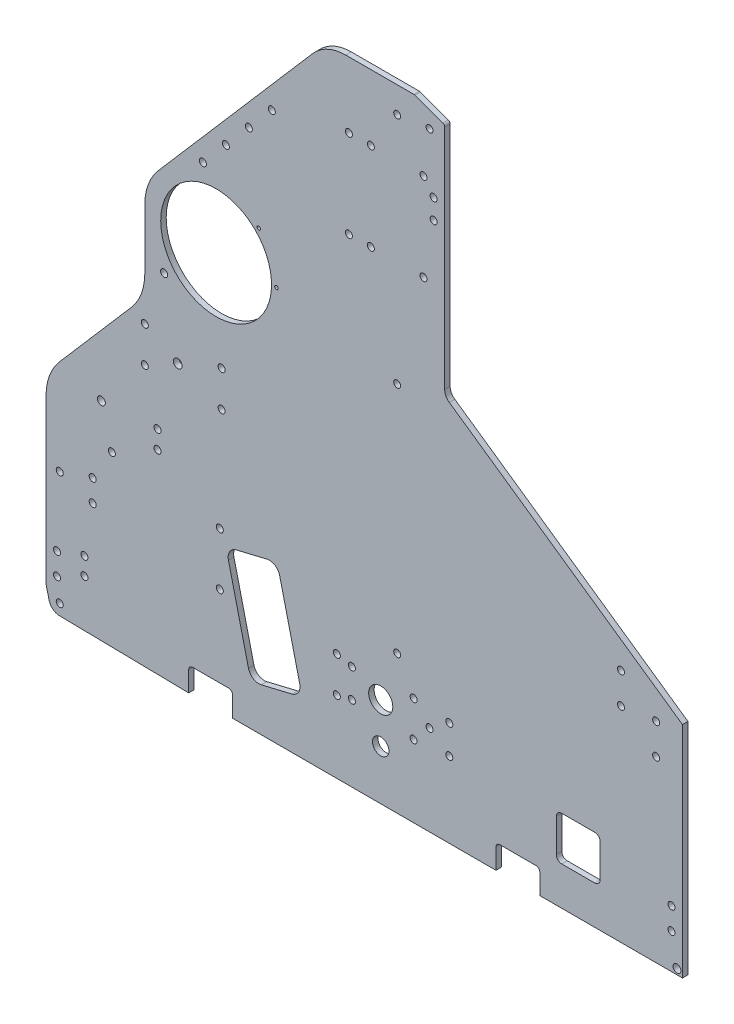
from build123d import *

# Parameters (mm, degrees)
SKETCH1_R           = 2.032
SKETCH1_R_2         = 2.54
SKETCH1_R_3         = 2
BOSS_EXTRUDE1_DEPTH = 3.175
FILLET1_R           = 2.286
FILLET2_R           = 6.35
SKETCH2_R           = 2.032
CUT_EXTRUDE1_DEPTH  = 505.524983177
FILLET3_R           = 1.5875
SKETCH3_R           = 2.032
SKETCH3_R_2         = 2.286
SKETCH3_R_3         = 1.016
CUT_EXTRUDE2_DEPTH  = 505.524983177
SKETCH4_R           = 2.032
SKETCH4_R_2         = 6.985
SKETCH4_R_3         = 4.7625
CUT_EXTRUDE3_DEPTH  = 505.524983177
SKETCH5_R           = 32.0675
SKETCH5_R_2         = 2.286
CUT_EXTRUDE5_DEPTH  = 540.282511836
FILLET4_R           = 31.75
CUT_EXTRUDE6_DEPTH  = 505.524983177
FILLET5_R           = 25.4
SKETCH8_R           = 2.032
CUT_EXTRUDE7_DEPTH  = 505.524983177


with BuildPart() as part:
    # Sketch1 → Boss-Extrude1 (new body)
    with BuildSketch(Plane.XY):
        with BuildLine():
            Line((7.829508682, -19.049081656), (82.55, -20.32))
            Line((82.55, -20.32), (82.55, -6.35))
            Line((82.55, -6.35), (107.95, -6.35))
            Line((107.95, -6.35), (107.95, -20.32))
            Line((107.95, -20.32), (260.35, -20.32))
            Line((260.35, -20.32), (260.35, -6.35))
            Line((260.35, -6.35), (285.75, -6.35))
            Line((285.75, -6.35), (285.75, -20.32))
            Line((285.75, -20.32), (368.3, -20.32))
            Line((368.3, -20.32), (368.3, 106.68))
            Line((368.3, 106.68), (230.66375, 202.565))
            Line((230.66375, 202.565), (230.66375, 338.455))
            Line((230.66375, 338.455), (213.19998, 344.805))
            Line((213.19998, 344.805), (203.2, 344.805))
            Line((203.2, 344.805), (161.925, 344.805))
            Line((161.925, 344.805), (52.720122664, 218.469945827))
            ThreePointArc((52.720122664, 218.469945827), (52.803835479, 218.142145922), (52.832, 217.805))
            ThreePointArc((52.832, 217.805), (52.095493096, 216.239521914), (50.419872403, 215.808871996))
            Line((50.419872403, 215.808871996), (0, 157.48))
            Line((0, 157.48), (0, 0))
            Line((0, 0), (0, -6.35))
            ThreePointArc((0, -6.35), (0.047577015, -7.125863724), (0.189595124, -7.890101219))
            Line((0.189595124, -7.890101219), (1.777095124, -14.240101219))
            ThreePointArc((1.777095124, -14.240101219), (3.987212552, -17.671692778), (7.829508682, -19.049081656))
        make_face()
        with Locations((7.9375, -12.7)):
            Circle(SKETCH1_R, mode=Mode.SUBTRACT)
        with Locations((6.35, 0)):
            Circle(SKETCH1_R, mode=Mode.SUBTRACT)
        with Locations((6.35, 12.7)):
            Circle(SKETCH1_R, mode=Mode.SUBTRACT)
        with Locations((38.1, 78.105)):
            Circle(SKETCH1_R, mode=Mode.SUBTRACT)
        with Locations((57.15, 131.28625)):
            Circle(SKETCH1_R, mode=Mode.SUBTRACT)
        with Locations((57.15, 151.92375)):
            Circle(SKETCH1_R, mode=Mode.SUBTRACT)
        with Locations((76.2, 141.605)):
            Circle(SKETCH1_R_2, mode=Mode.SUBTRACT)
        with Locations((101.6, 131.28625)):
            Circle(SKETCH1_R, mode=Mode.SUBTRACT)
        with Locations((101.6, 151.92375)):
            Circle(SKETCH1_R, mode=Mode.SUBTRACT)
        with Locations((203.2, 59.805)):
            Circle(SKETCH1_R_3, mode=Mode.SUBTRACT)
        with Locations((361.95, 0)):
            Circle(SKETCH1_R, mode=Mode.SUBTRACT)
        with Locations((361.95, 12.7)):
            Circle(SKETCH1_R, mode=Mode.SUBTRACT)
        with Locations((353.06, 82.955052336)):
            Circle(SKETCH1_R, mode=Mode.SUBTRACT)
        with Locations((332.74, 98.195052336)):
            Circle(SKETCH1_R, mode=Mode.SUBTRACT)
        with Locations((332.74, 115.975052336)):
            Circle(SKETCH1_R, mode=Mode.SUBTRACT)
        with Locations((353.06, 100.735052336)):
            Circle(SKETCH1_R, mode=Mode.SUBTRACT)
        with Locations((68.326, 182.923674932)):
            Circle(SKETCH1_R, mode=Mode.SUBTRACT)
        with Locations((76.2, 217.805)):
            Circle(SKETCH1_R, mode=Mode.SUBTRACT)
        with Locations((90.779500502, 249.682)):
            Circle(SKETCH1_R, mode=Mode.SUBTRACT)
        with Locations((104.067838673, 265.054783374)):
            Circle(SKETCH1_R, mode=Mode.SUBTRACT)
        with Locations((117.356176844, 280.427566748)):
            Circle(SKETCH1_R, mode=Mode.SUBTRACT)
        with Locations((130.644515014, 295.800350122)):
            Circle(SKETCH1_R, mode=Mode.SUBTRACT)
        with Locations((203.2, 194.805)):
            Circle(SKETCH1_R_3, mode=Mode.SUBTRACT)
        with Locations((224.31375, 287.401)):
            Circle(SKETCH1_R, mode=Mode.SUBTRACT)
        with Locations((224.31375, 298.831)):
            Circle(SKETCH1_R, mode=Mode.SUBTRACT)
        with Locations((203.2, 329.805)):
            Circle(SKETCH1_R_3, mode=Mode.SUBTRACT)
        with Locations((221.931865, 332.105)):
            Circle(SKETCH1_R_3, mode=Mode.SUBTRACT)
    extrude(amount=BOSS_EXTRUDE1_DEPTH)

    # Fillet1
    fillet1_edges = [part.edges().sort_by_distance(p)[0] for p in [
        (285.75, -6.35, 1.5875),
        (107.95, -6.35, 1.5875),
        (260.35, -6.35, 1.5875),
        (82.55, -6.35, 1.5875),
    ]]
    fillet(fillet1_edges, radius=FILLET1_R)

    # Fillet2
    fillet2_edges = [part.edges().sort_by_distance(p)[0] for p in [
        (230.66375, 202.565, 1.5875),
    ]]
    fillet(fillet2_edges, radius=FILLET2_R)

    # Sketch2 → Cut-Extrude1 (cut, through all)
    with BuildSketch(Plane(origin=(0, 0, 0), x_dir=(-1, 0, 0), z_dir=(0, 0, -1))):
        with Locations((-100.552770272, 71.086035298)):
            Circle(SKETCH2_R)
        with Locations((-100.552770272, 40.606035298)):
            Circle(SKETCH2_R)
        with Locations((-22.225, 18.202541089)):
            Circle(SKETCH2_R)
        with Locations((-22.225, 8.042541089)):
            Circle(SKETCH2_R)
    extrude(amount=-CUT_EXTRUDE1_DEPTH, mode=Mode.SUBTRACT)

    # Fillet3
    fillet3_edges = [part.edges().sort_by_distance(p)[0] for p in [
        (230.66375, 338.455, 1.5875),
        (213.19998, 344.805, 1.5875),
    ]]
    fillet(fillet3_edges, radius=FILLET3_R)

    # Sketch3 → Cut-Extrude2 (cut, through all)
    with BuildSketch(Plane.XY.offset(3.175)):
        with BuildLine():
            Line((127.789350211, 69.359774106), (110.090750339, 65.117184968))
            ThreePointArc((110.090750339, 65.117184968), (106.287939856, 62.356288953), (105.55119507, 57.715047577))
            Line((105.55119507, 57.715047577), (117.160037875, 9.287010566))
            ThreePointArc((117.160037875, 9.287010566), (119.92093389, 5.484200083), (124.562175266, 4.747455297))
            Line((124.562175266, 4.747455297), (142.260775137, 8.990044434))
            ThreePointArc((142.260775137, 8.990044434), (146.063585621, 11.75094045), (146.800330407, 16.392181825))
            Line((146.800330407, 16.392181825), (135.191487602, 64.820218836))
            ThreePointArc((135.191487602, 64.820218836), (132.430591586, 68.62302932), (127.789350211, 69.359774106))
        make_face()
        with Locations((26.987500002, 46.953113935)):
            Circle(SKETCH3_R)
        with Locations((26.987500002, 59.653113935)):
            Circle(SKETCH3_R)
        with Locations((7.937500002, 53.303113935)):
            Circle(SKETCH3_R)
        with Locations((32.030600738, 100.810868776)):
            Circle(SKETCH3_R_2)
        with Locations((64.525942114, 102.94048958)):
            Circle(SKETCH3_R)
        with Locations((64.525942114, 92.525786339)):
            Circle(SKETCH3_R)
        with Locations((133.35, 208.228121768)):
            Circle(SKETCH3_R_3)
        with Locations((123.120704333, 232.923826101)):
            Circle(SKETCH3_R_3)
    extrude(amount=-CUT_EXTRUDE2_DEPTH, mode=Mode.SUBTRACT)

    # Sketch4 → Cut-Extrude3 (cut, through all)
    with BuildSketch(Plane.XY.offset(3.175)):
        with Locations((168.275, 42.06875)):
            Circle(SKETCH4_R)
        with Locations((212.725, 42.06875)):
            Circle(SKETCH4_R)
        with Locations((212.725, 21.43125)):
            Circle(SKETCH4_R)
        with Locations((168.275, 21.43125)):
            Circle(SKETCH4_R)
        with Locations((193.675, 31.75)):
            Circle(SKETCH4_R_2)
        with Locations((177.00498, 40.0431)):
            Circle(SKETCH4_R)
        with Locations((177.00498, 23.4569)):
            Circle(SKETCH4_R)
        with Locations((193.675, 8.466666658)):
            Circle(SKETCH4_R_3)
        with Locations((221.931865, 31.75)):
            Circle(SKETCH4_R)
        with Locations((233.36123, 23.4569)):
            Circle(SKETCH4_R)
        with Locations((233.36123, 40.0431)):
            Circle(SKETCH4_R)
    extrude(amount=-CUT_EXTRUDE3_DEPTH, mode=Mode.SUBTRACT)

    # Sketch5 → Cut-Extrude5 (cut, through all)
    with BuildSketch(Plane(origin=(0, 0, -187.324998812), x_dir=(-1, 0, 0), z_dir=(0, 0, -1))):
        Polygon((0, 157.48), (-57.15, 223.594705882), (-57.15, 165.333696112), (0, 99.218990229), align=None)
        with Locations((-98.425, 208.228121768)):
            Circle(SKETCH5_R)
        with Locations((-365.124993903, -17.144956474)):
            Circle(SKETCH5_R_2)
    extrude(amount=-CUT_EXTRUDE5_DEPTH, mode=Mode.SUBTRACT)

    # Fillet4
    fillet4_edges = [part.edges().sort_by_distance(p)[0] for p in [
        (0, 99.218990229, 1.5875),
        (57.15, 165.333696112, 1.5875),
        (57.15, 223.594705882, 1.5875),
    ]]
    fillet(fillet4_edges, radius=FILLET4_R)

    # Sketch6 → Cut-Extrude6 (cut, through all)
    with BuildSketch(Plane.XY.offset(3.175)):
        with BuildLine():
            Line((298.45, 27.305), (317.5, 27.305))
            ThreePointArc((317.5, 27.305), (319.74506403, 26.37506403), (320.675, 24.13))
            Line((320.675, 24.13), (320.675, 5.08))
            ThreePointArc((320.675, 5.08), (319.74506403, 2.83493597), (317.5, 1.905))
            Line((317.5, 1.905), (298.45, 1.905))
            ThreePointArc((298.45, 1.905), (296.20493597, 2.83493597), (295.275, 5.08))
            Line((295.275, 5.08), (295.275, 24.13))
            ThreePointArc((295.275, 24.13), (296.20493597, 26.37506403), (298.45, 27.305))
        make_face()
    extrude(amount=-CUT_EXTRUDE6_DEPTH, mode=Mode.SUBTRACT)

    # Fillet5
    fillet5_edges = [part.edges().sort_by_distance(p)[0] for p in [
        (161.925, 344.805, 1.5875),
    ]]
    fillet(fillet5_edges, radius=FILLET5_R)

    # Sketch8 → Cut-Extrude7 (cut, through all)
    with BuildSketch(Plane(origin=(0, 0, 0), x_dir=(-1, 0, 0), z_dir=(0, 0, -1))):
        with Locations((-187.96, 306.705)):
            Circle(SKETCH8_R)
        with Locations((-175.26, 306.705)):
            Circle(SKETCH8_R)
        with Locations((-218.44, 306.705)):
            Circle(SKETCH8_R)
        with Locations((-218.44, 255.905)):
            Circle(SKETCH8_R)
        with Locations((-187.96, 255.905)):
            Circle(SKETCH8_R)
        with Locations((-175.26, 255.905)):
            Circle(SKETCH8_R)
    extrude(amount=-CUT_EXTRUDE7_DEPTH, mode=Mode.SUBTRACT)


solid = part.part
